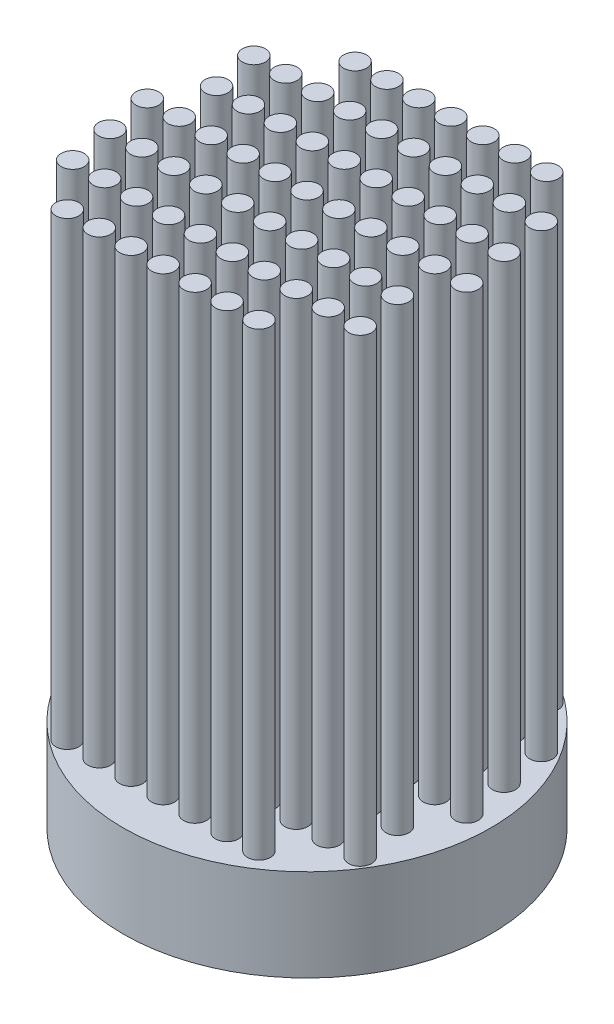
from build123d import *

# Parameters (mm, degrees)
SKETCH3_R               = 0.25
SKETCH1_R               = 4
BOSS_EXTRUDE1_DEPTH     = 2
FILL_PATTERN2_OUTLINE_R = 0.25
FILL_PATTERN2_DEPTH     = 10


# Read off the part's stored shape, not the designer's step: Fill Pattern2
with BuildPart() as part:
    # Sweep1: sweep along a path in Sketch2
    with BuildLine(Plane(origin=(0, 0, 0), x_dir=(0, 0, -1), z_dir=(1, 0, 0))) as sweep1_path:
        Line((0, 0), (0, 10))
    # Sketch3 → Sweep1 (sweep)
    with BuildSketch(Plane(origin=(0, 0, 0), x_dir=(1, 0, 0), z_dir=(0, 1, 0))):
        Circle(SKETCH3_R)
    sweep(path=sweep1_path.line)

    # Sketch1 → Boss-Extrude1 (add)
    with BuildSketch(Plane(origin=(0, 0, 0), x_dir=(1, 0, 0), z_dir=(0, 1, 0))):
        with Locations(Location((0, 0, 0), (0, 0, 270))):
            Circle(SKETCH1_R)
    extrude(amount=-BOSS_EXTRUDE1_DEPTH)

    # Fill Pattern2 outline → Fill Pattern2 (add)
    with BuildSketch(Plane(origin=(0, 0, 0), x_dir=(1, 0, 0), z_dir=(0, 1, 0))):
        with Locations((-3.472963553, 0)):
            Circle(FILL_PATTERN2_OUTLINE_R)
        with Locations((-3.299315376, -0.984807753)):
            Circle(FILL_PATTERN2_OUTLINE_R)
        with Locations((-3.125667198, -1.969615506)):
            Circle(FILL_PATTERN2_OUTLINE_R)
        with Locations((-3.125667198, 1.969615506)):
            Circle(FILL_PATTERN2_OUTLINE_R)
        with Locations((-2.95201902, 0.984807753)):
            Circle(FILL_PATTERN2_OUTLINE_R)
        with Locations((-2.778370843, 0)):
            Circle(FILL_PATTERN2_OUTLINE_R)
        with Locations((-2.604722665, -0.984807753)):
            Circle(FILL_PATTERN2_OUTLINE_R)
        with Locations((-2.431074487, -1.969615506)):
            Circle(FILL_PATTERN2_OUTLINE_R)
        with Locations((-2.25742631, -2.954423259)):
            Circle(FILL_PATTERN2_OUTLINE_R)
        with Locations((-2.431074487, 1.969615506)):
            Circle(FILL_PATTERN2_OUTLINE_R)
        with Locations((-2.25742631, 0.984807753)):
            Circle(FILL_PATTERN2_OUTLINE_R)
        with Locations((-2.083778132, 0)):
            Circle(FILL_PATTERN2_OUTLINE_R)
        with Locations((-1.910129954, -0.984807753)):
            Circle(FILL_PATTERN2_OUTLINE_R)
        with Locations((-1.736481777, -1.969615506)):
            Circle(FILL_PATTERN2_OUTLINE_R)
        with Locations((-1.562833599, -2.954423259)):
            Circle(FILL_PATTERN2_OUTLINE_R)
        with Locations((-1.910129954, 2.954423259)):
            Circle(FILL_PATTERN2_OUTLINE_R)
        with Locations((-1.736481777, 1.969615506)):
            Circle(FILL_PATTERN2_OUTLINE_R)
        with Locations((-1.562833599, 0.984807753)):
            Circle(FILL_PATTERN2_OUTLINE_R)
        with Locations((-1.389185421, 0)):
            Circle(FILL_PATTERN2_OUTLINE_R)
        with Locations((-1.215537244, -0.984807753)):
            Circle(FILL_PATTERN2_OUTLINE_R)
        with Locations((-1.041889066, -1.969615506)):
            Circle(FILL_PATTERN2_OUTLINE_R)
        with Locations((-0.868240888, -2.954423259)):
            Circle(FILL_PATTERN2_OUTLINE_R)
        with Locations((-1.215537244, 2.954423259)):
            Circle(FILL_PATTERN2_OUTLINE_R)
        with Locations((-1.041889066, 1.969615506)):
            Circle(FILL_PATTERN2_OUTLINE_R)
        with Locations((-0.868240888, 0.984807753)):
            Circle(FILL_PATTERN2_OUTLINE_R)
        with Locations((-0.694592711, 0)):
            Circle(FILL_PATTERN2_OUTLINE_R)
        with Locations((-0.520944533, -0.984807753)):
            Circle(FILL_PATTERN2_OUTLINE_R)
        with Locations((-0.347296355, -1.969615506)):
            Circle(FILL_PATTERN2_OUTLINE_R)
        with Locations((-0.173648178, -2.954423259)):
            Circle(FILL_PATTERN2_OUTLINE_R)
        with Locations((-0.520944533, 2.954423259)):
            Circle(FILL_PATTERN2_OUTLINE_R)
        with Locations((-0.347296355, 1.969615506)):
            Circle(FILL_PATTERN2_OUTLINE_R)
        with Locations((-0.173648178, 0.984807753)):
            Circle(FILL_PATTERN2_OUTLINE_R)
        with Locations((0.173648178, -0.984807753)):
            Circle(FILL_PATTERN2_OUTLINE_R)
        with Locations((0.347296355, -1.969615506)):
            Circle(FILL_PATTERN2_OUTLINE_R)
        with Locations((0.520944533, -2.954423259)):
            Circle(FILL_PATTERN2_OUTLINE_R)
        with Locations((0.173648178, 2.954423259)):
            Circle(FILL_PATTERN2_OUTLINE_R)
        with Locations((0.347296355, 1.969615506)):
            Circle(FILL_PATTERN2_OUTLINE_R)
        with Locations((0.520944533, 0.984807753)):
            Circle(FILL_PATTERN2_OUTLINE_R)
        with Locations((0.694592711, 0)):
            Circle(FILL_PATTERN2_OUTLINE_R)
        with Locations((0.868240888, -0.984807753)):
            Circle(FILL_PATTERN2_OUTLINE_R)
        with Locations((1.041889066, -1.969615506)):
            Circle(FILL_PATTERN2_OUTLINE_R)
        with Locations((1.215537244, -2.954423259)):
            Circle(FILL_PATTERN2_OUTLINE_R)
        with Locations((0.868240888, 2.954423259)):
            Circle(FILL_PATTERN2_OUTLINE_R)
        with Locations((1.041889066, 1.969615506)):
            Circle(FILL_PATTERN2_OUTLINE_R)
        with Locations((1.215537244, 0.984807753)):
            Circle(FILL_PATTERN2_OUTLINE_R)
        with Locations((1.389185421, 0)):
            Circle(FILL_PATTERN2_OUTLINE_R)
        with Locations((1.562833599, -0.984807753)):
            Circle(FILL_PATTERN2_OUTLINE_R)
        with Locations((1.736481777, -1.969615506)):
            Circle(FILL_PATTERN2_OUTLINE_R)
        with Locations((1.910129954, -2.954423259)):
            Circle(FILL_PATTERN2_OUTLINE_R)
        with Locations((1.562833599, 2.954423259)):
            Circle(FILL_PATTERN2_OUTLINE_R)
        with Locations((1.736481777, 1.969615506)):
            Circle(FILL_PATTERN2_OUTLINE_R)
        with Locations((1.910129954, 0.984807753)):
            Circle(FILL_PATTERN2_OUTLINE_R)
        with Locations((2.083778132, 0)):
            Circle(FILL_PATTERN2_OUTLINE_R)
        with Locations((2.25742631, -0.984807753)):
            Circle(FILL_PATTERN2_OUTLINE_R)
        with Locations((2.431074487, -1.969615506)):
            Circle(FILL_PATTERN2_OUTLINE_R)
        with Locations((2.25742631, 2.954423259)):
            Circle(FILL_PATTERN2_OUTLINE_R)
        with Locations((2.431074487, 1.969615506)):
            Circle(FILL_PATTERN2_OUTLINE_R)
        with Locations((2.604722665, 0.984807753)):
            Circle(FILL_PATTERN2_OUTLINE_R)
        with Locations((2.778370843, 0)):
            Circle(FILL_PATTERN2_OUTLINE_R)
        with Locations((2.95201902, -0.984807753)):
            Circle(FILL_PATTERN2_OUTLINE_R)
        with Locations((3.125667198, -1.969615506)):
            Circle(FILL_PATTERN2_OUTLINE_R)
        with Locations((3.125667198, 1.969615506)):
            Circle(FILL_PATTERN2_OUTLINE_R)
        with Locations((3.299315376, 0.984807753)):
            Circle(FILL_PATTERN2_OUTLINE_R)
        with Locations((3.472963553, 0)):
            Circle(FILL_PATTERN2_OUTLINE_R)
    extrude(amount=FILL_PATTERN2_DEPTH)


solid = part.part
